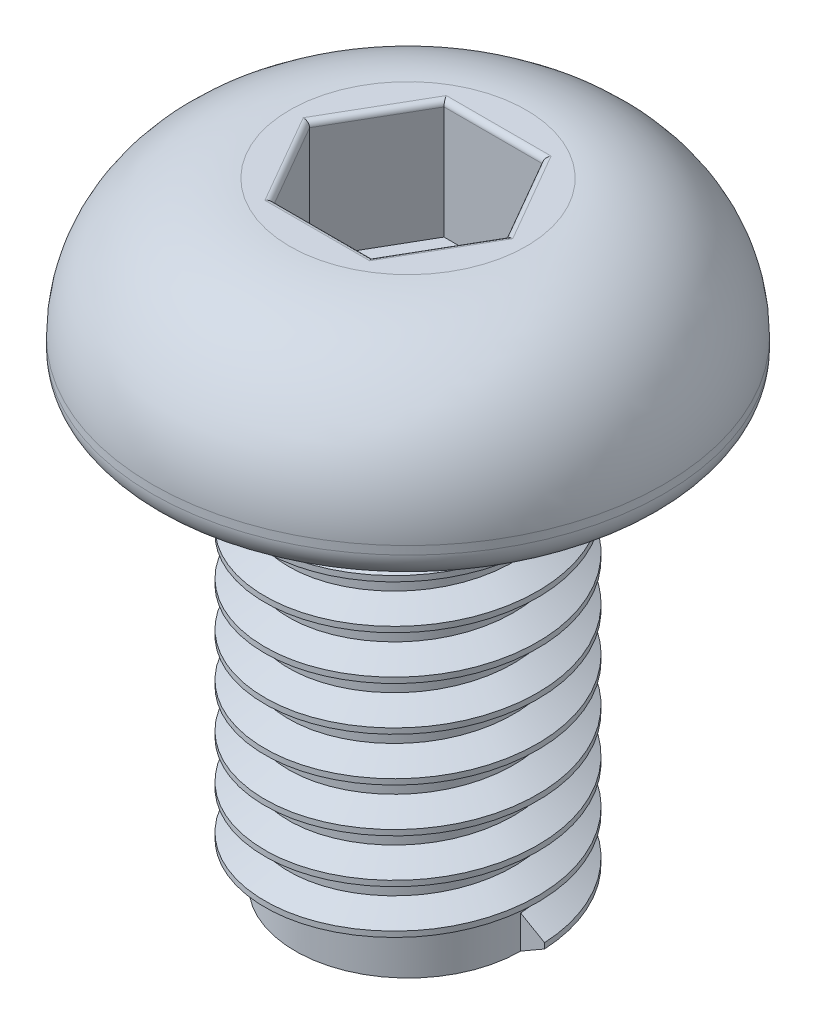
from build123d import *

# Parameters (mm, degrees)
SKETCH1_R           = 2.05
BOSS_EXTRUDE1_DEPTH = 8
SKETCH2_R           = 4.65
BOSS_EXTRUDE2_DEPTH = 3.15
CUT_EXTRUDE1_DEPTH  = 2.15
FILLET1_R           = 2.5
FILLET2_R           = 0.5
FILLET3_R           = 0.1
THREAD1_PITCH       = 0.8


with BuildPart() as part:
    # Sketch1 → Boss-Extrude1 (new body)
    with BuildSketch(Plane(origin=(0, 0, 0), x_dir=(1, 0, 0), z_dir=(0, 1, 0))):
        with Locations(Location((0, 0, 0), (0, 0, 270))):
            Circle(SKETCH1_R)
    extrude(amount=-BOSS_EXTRUDE1_DEPTH)

    # Sketch2 → Boss-Extrude2 (add)
    with BuildSketch(Plane(origin=(0, 0, 0), x_dir=(1, 0, 0), z_dir=(0, 1, 0))):
        with Locations(Location((0, 0, 0), (0, 0, 270))):
            Circle(SKETCH2_R)
    extrude(amount=BOSS_EXTRUDE2_DEPTH)

    # Sketch3 → Cut-Extrude1 (cut)
    with BuildSketch(Plane(origin=(0, 3.15, 0), x_dir=(1, 0, 0), z_dir=(0, 1, 0))):
        Polygon((1.789785834, 0), (0.894892917, 1.55), (-0.894892917, 1.55), (-1.789785834, 0), (-0.894892917, -1.55), (0.894892917, -1.55), align=None)
    extrude(amount=-CUT_EXTRUDE1_DEPTH, mode=Mode.SUBTRACT)

    # Fillet1
    fillet1_edges = [part.edges().sort_by_distance(p)[0] for p in [
        (0, 3.15, -4.65),
    ]]
    fillet(fillet1_edges, radius=FILLET1_R)

    # Fillet2
    fillet2_edges = [part.edges().sort_by_distance(p)[0] for p in [
        (0, 0, -4.65),
    ]]
    fillet(fillet2_edges, radius=FILLET2_R)

    # Fillet3
    fillet3_edges = [part.edges().sort_by_distance(p)[0] for p in [
        (1.342339376, 3.15, 0.775),
        (1.342339376, 3.15, -0.775),
        (0, 3.15, -1.55),
        (-1.342339376, 3.15, -0.775),
        (-1.342339376, 3.15, 0.775),
        (0, 3.15, 1.55),
    ]]
    fillet(fillet3_edges, radius=FILLET3_R)

    # Thread1: the profile of Thread Profile1 profile screwed along a right-hand helix of 10 turns, 8 arcs to a turn; built about Z, then put on its axis
    thread1_z = Axis((0, 0, 0), (0, 0, 1))
    thread1_corners = [(2.0497, 0, -0.000173205), (2.4830127, 0, 0.249999999), (2.4830127, 0, 0.349999999), (2.0497, 0, 0.600173203)]
    with BuildLine(mode=Mode.PRIVATE) as thread1_profile:
        Line(thread1_corners[0], thread1_corners[1])
        Line(thread1_corners[1], thread1_corners[2])
        Line(thread1_corners[2], thread1_corners[3])
        Line(thread1_corners[3], thread1_corners[0])
    thread1_cap = Face(thread1_profile.wire())
    thread1_turn_angles = [0, 22.5, 45, 67.5, 90, 112.5, 135, 157.5, 180, 202.5, 225, 247.5, 270, 292.5, 315, 337.5, 360]
    thread1_turn_weights = [1, 0.9238795325112867, 1, 0.9238795325112867, 1, 0.9238795325112867, 1, 0.9238795325112867, 1, 0.9238795325112867, 1, 0.9238795325112867, 1, 0.9238795325112867, 1, 0.9238795325112867, 1]
    thread1_turn_rails = [Edge.make_bspline([Vector(p[0], p[1], 0).rotate(thread1_z, thread1_turn_angles[k]) / thread1_turn_weights[k] + Vector(0, 0, p[2] + THREAD1_PITCH * thread1_turn_angles[k] / 360) for k in range(17)], [0, 0, 0, 1, 1, 2, 2, 3, 3, 4, 4, 5, 5, 6, 6, 7, 7, 8, 8, 8], 2, thread1_turn_weights) for p in thread1_corners]
    thread1_turn_sides = [Face.make_surface_from_curves(thread1_turn_rails[p[0]], thread1_turn_rails[p[1]]) for p in [(0, 1), (1, 2), (2, 3), (3, 0)]]
    thread1 = Plane(origin=(0, -8, 0), x_dir=(1, 0, 0), z_dir=(0, 1, 0)) * Solid(Shell([*[p.moved(Location((0, 0, THREAD1_PITCH * i))) for i in range(10) for p in thread1_turn_sides], thread1_cap, thread1_cap.rotate(thread1_z, 3600).moved(Location((0, 0, THREAD1_PITCH * 3600 / 360)))]))
    add(thread1)


solid = part.part
